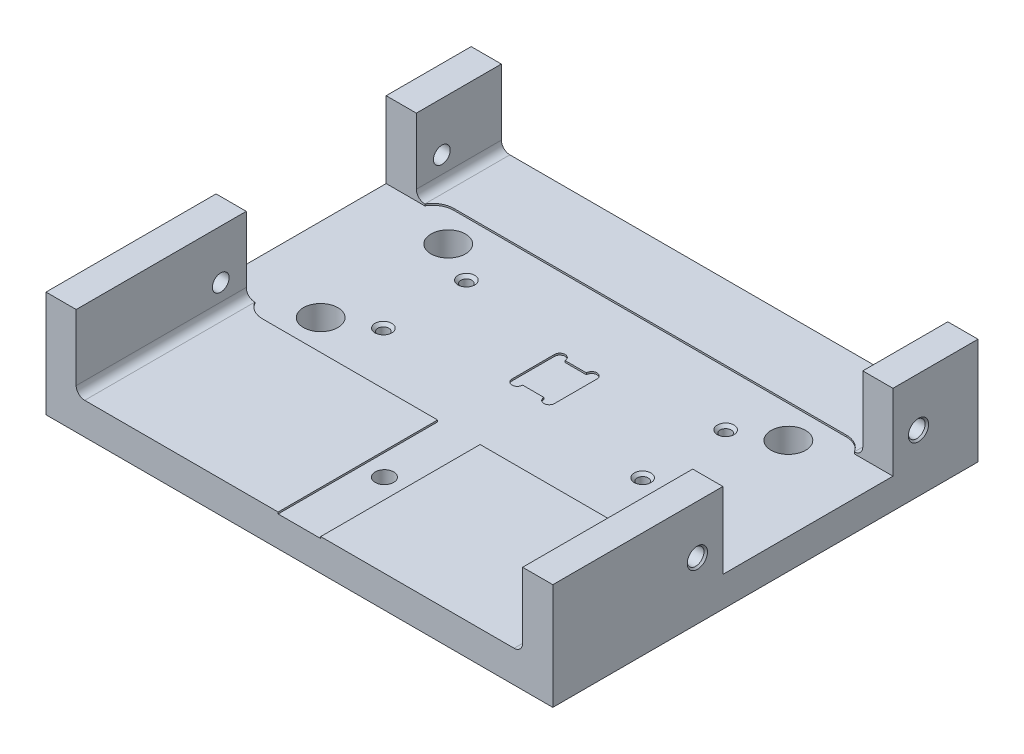
from build123d import *

# Parameters (mm, degrees)
EXTRUDE_THIN1_DEPTH                     = 50.8
FILLET2_R                               = 2.54
CUT_EXTRUDE1_DEPTH                      = 97.928543268
CUT_EXTRUDE1_DEPTH_BACK                 = 97.928543268
SKETCH5_W                               = 25.4
SKETCH5_H                               = 22.733
CUT_EXTRUDE2_START                      = 9.017
CUT_EXTRUDE2_DEPTH                      = 0.508
CUT_EXTRUDE3_START                      = -76.2
SKETCH8_W                               = 50.8
SKETCH8_H                               = 31.75
CUT_EXTRUDE3_DEPTH                      = 0.508
M4X0_7_TAPPED_HOLE2_D                   = 3.3
M4X0_7_TAPPED_HOLE2_CSINK_D             = 5
M4X0_7_TAPPED_HOLE2_CSINK_ANGLE         = 90
M6X1_0_TAPPED_HOLE1_D                   = 5
M6X1_0_TAPPED_HOLE1_CSINK_D             = 6.05
M6X1_0_TAPPED_HOLE1_CSINK_ANGLE         = 90
MIRROR1_2_OUTLINE_R                     = 1.65
MIRROR1_2_DEPTH                         = 9.017
MIRROR1_START                           = 9.017
MIRROR1_3_OUTLINE_W                     = 75.692
MIRROR1_3_OUTLINE_H                     = 25.4
MIRROR1_3_OUTLINE_W_2                   = 151.384
MIRROR1_3_DEPTH                         = 3.048
MIRROR1_START_2                         = 9.8422079
MIRROR1_4_OUTLINE_W                     = 9.017
MIRROR1_4_OUTLINE_H                     = 25.4
MIRROR1_4_DEPTH                         = 21.9077921
MIRROR1_5_DEPTH                         = 8.509
MIRROR1_START_3                         = -50.8
MIRROR1_6_DEPTH                         = 101.6
SKETCH14_W                              = 12.7
SKETCH14_H                              = 50.8
CUT_EXTRUDE4_DEPTH                      = 0.508
BOSS_EXTRUDE1_DEPTH                     = 25.4
CBORE_FOR_M5_HEX_HEAD_BOLT1_D           = 5.5
CBORE_FOR_M5_HEX_HEAD_BOLT1_DEPTH       = 12.3063
CBORE_FOR_M5_HEX_HEAD_BOLT1_CBORE_D     = 12.24
CBORE_FOR_M5_HEX_HEAD_BOLT1_CBORE_DEPTH = 3.58
CBORE_FOR_M5_HEX_HEAD_BOLT1_TIP         = 1.652366702
CUT_EXTRUDE6_DEPTH                      = 0.508
FILLET3_R                               = 6.35


with BuildPart() as part:
    # Sketch4 → Extrude-Thin1 (new body)
    with BuildSketch(Plane.XY):
        Polygon((0, 0), (-76.2, 0), (-76.2, 31.75), (-66.675, 31.75), (-66.675, 9.525), (0, 9.525), align=None)
    extrude(amount=EXTRUDE_THIN1_DEPTH)

    # Fillet2
    fillet2_edges = [part.edges().sort_by_distance(p)[0] for p in [
        (-66.675, 9.525, 25.4),
    ]]
    fillet(fillet2_edges, radius=FILLET2_R)

    # Sketch5 → Cut-Extrude1 (cut, two sides: drawn at the far end of the back side and taken through both)
    with BuildSketch(Plane(origin=(0, 0, 0), x_dir=(0, 0, -1), z_dir=(1, 0, 0)).offset(-CUT_EXTRUDE1_DEPTH_BACK)):
        with Locations((-12.7, 20.3835)):
            Rectangle(SKETCH5_W, SKETCH5_H)
    extrude(amount=CUT_EXTRUDE1_DEPTH + CUT_EXTRUDE1_DEPTH_BACK, mode=Mode.SUBTRACT)

    # Sketch7 → Cut-Extrude2 (cut)
    with BuildSketch(Plane(origin=(0, 0, 0), x_dir=(1, 0, 0), z_dir=(0, 1, 0)).offset(CUT_EXTRUDE2_START)):
        with BuildLine():
            Line((0, 0), (-6.35, 0))
            Line((-6.35, 0), (-6.35, -6.35))
            ThreePointArc((-6.35, -6.35), (-4.7625, -7.9375), (-3.175, -6.35))
            Line((-3.175, -6.35), (0, -6.35))
            Line((0, -6.35), (0, 0))
        make_face()
    extrude(amount=-CUT_EXTRUDE2_DEPTH, mode=Mode.SUBTRACT)

    # Sketch8 → Cut-Extrude3 (cut)
    with BuildSketch(Plane(origin=(0, 0, 0), x_dir=(0, 0, -1), z_dir=(1, 0, 0)).offset(CUT_EXTRUDE3_START)):
        with Locations((-25.4, 15.875)):
            Rectangle(SKETCH8_W, SKETCH8_H)
    extrude(amount=CUT_EXTRUDE3_DEPTH, mode=Mode.SUBTRACT)

    # M4x0.7 Tapped Hole2 (through all)
    with Locations(Plane(origin=(0, 9.017, 0), x_dir=(1, 0, 0), z_dir=(0, 1, 0))):
        with Locations((-38.718585116, -12.4)):
            CounterSinkHole(M4X0_7_TAPPED_HOLE2_D / 2, M4X0_7_TAPPED_HOLE2_CSINK_D / 2, counter_sink_angle=M4X0_7_TAPPED_HOLE2_CSINK_ANGLE)

    # M6x1.0 Tapped Hole1 (through all)
    with Locations(Plane.ZY.offset(75.692)):
        with Locations((33.02, 17.145)):
            CounterSinkHole(M6X1_0_TAPPED_HOLE1_D / 2, M6X1_0_TAPPED_HOLE1_CSINK_D / 2, counter_sink_angle=M6X1_0_TAPPED_HOLE1_CSINK_ANGLE)

    # Mirror1 2 outline → Mirror1 2 (add)
    with BuildSketch(Plane(origin=(0, 0, 0), x_dir=(1, 0, 0), z_dir=(0, 1, 0))):
        with BuildLine():
            Line((75.692, -50.8), (75.692, 50.8))
            Line((75.692, 50.8), (-75.692, 50.8))
            Line((-75.692, 50.8), (-75.692, 0))
            Line((-75.692, 0), (-6.35, 0))
            Line((-6.35, 0), (-6.35, 6.35))
            ThreePointArc((-6.35, 6.35), (-4.7625, 7.9375), (-3.175, 6.35))
            Line((-3.175, 6.35), (3.175, 6.35))
            ThreePointArc((3.175, 6.35), (4.7625, 7.9375), (6.35, 6.35))
            Line((6.35, 6.35), (6.35, -6.35))
            ThreePointArc((6.35, -6.35), (4.7625, -7.9375), (3.175, -6.35))
            Line((3.175, -6.35), (0, -6.35))
            Line((0, -6.35), (0, -50.8))
            Line((0, -50.8), (75.692, -50.8))
        make_face()
        with Locations((38.718585116, 12.4)):
            Circle(MIRROR1_2_OUTLINE_R, mode=Mode.SUBTRACT)
        with Locations((-38.718585116, 12.4)):
            Circle(MIRROR1_2_OUTLINE_R, mode=Mode.SUBTRACT)
        with Locations((38.718585116, -12.4)):
            Circle(MIRROR1_2_OUTLINE_R, mode=Mode.SUBTRACT)
    extrude(amount=MIRROR1_2_DEPTH)

    # Mirror1 3 outline → Mirror1 3 (add)
    with BuildSketch(Plane(origin=(0, 0, 0), x_dir=(1, 0, 0), z_dir=(0, 1, 0)).offset(MIRROR1_START)):
        with Locations((37.846, -38.1)):
            Rectangle(MIRROR1_3_OUTLINE_W, MIRROR1_3_OUTLINE_H)
        with Locations((0, 38.1)):
            Rectangle(MIRROR1_3_OUTLINE_W_2, MIRROR1_3_OUTLINE_H)
    extrude(amount=MIRROR1_3_DEPTH)



with BuildPart() as body_2:
    # Mirror1: read off the stored shape, not the designer's step
    # Mirror1 outline → Mirror1 (revolve)
    with BuildSketch(Plane(origin=(0, 17.145, -33.02), x_dir=(0, 1, 0), z_dir=(0, 0, -1))):
        Polygon((3.025, -66.675), (2.5, -66.675), (2.5, -75.167), (3.025, -75.692), align=None)
        Polygon((2.5, 75.167), (2.5, 66.675), (3.025, 66.675), (3.025, 75.692), align=None)
    revolve(axis=Axis((0, 17.145, -33.02), (1, 0, 0)))


with BuildPart() as part_1:
    add(part.part)

    add(body_2.part)  # Mirror1 4 merges body 2
    # Mirror1 4 outline → Mirror1 4 (add)
    with BuildSketch(Plane(origin=(0, 0, 0), x_dir=(1, 0, 0), z_dir=(0, 1, 0)).offset(MIRROR1_START_2)):
        with Locations((71.1835, -38.1)):
            Rectangle(MIRROR1_4_OUTLINE_W, MIRROR1_4_OUTLINE_H)
        with Locations((71.1835, 38.1)):
            Rectangle(MIRROR1_4_OUTLINE_W, MIRROR1_4_OUTLINE_H)
        with Locations((-71.1835, 38.1)):
            Rectangle(MIRROR1_4_OUTLINE_W, MIRROR1_4_OUTLINE_H)
    extrude(amount=MIRROR1_4_DEPTH)

    # Mirror1 5 outline → Mirror1 5 (add)
    with BuildSketch(Plane(origin=(0, 0, 0), x_dir=(1, 0, 0), z_dir=(0, 1, 0))):
        with BuildLine():
            Line((0, 0), (0, -6.35))
            Line((0, -6.35), (3.175, -6.35))
            ThreePointArc((3.175, -6.35), (4.7625, -7.9375), (6.35, -6.35))
            Line((6.35, -6.35), (6.35, 6.35))
            ThreePointArc((6.35, 6.35), (4.7625, 7.9375), (3.175, 6.35))
            Line((3.175, 6.35), (-3.175, 6.35))
            ThreePointArc((-3.175, 6.35), (-4.7625, 7.9375), (-6.35, 6.35))
            Line((-6.35, 6.35), (-6.35, 0))
            Line((-6.35, 0), (0, 0))
        make_face()
    extrude(amount=MIRROR1_5_DEPTH)

    # Mirror1 6 outline → Mirror1 6 (cut)
    with BuildSketch(Plane.XY.offset(MIRROR1_START_3)):
        with BuildLine():
            ThreePointArc((-66.675, 12.065), (-65.931051224, 10.268948776), (-64.135, 9.525))
            Line((-64.135, 9.525), (64.135, 9.525))
            ThreePointArc((64.135, 9.525), (65.931051224, 10.268948776), (66.675, 12.065))
            Line((66.675, 12.065), (-66.675, 12.065))
        make_face()
    extrude(amount=MIRROR1_6_DEPTH, mode=Mode.SUBTRACT)

    # Mirror1 7 outline → Mirror1 7 (revolve, cut)
    with BuildSketch(Plane(origin=(0, 17.145, 33.02), x_dir=(0, 1, 0), z_dir=(0, 0, -1))):
        Polygon((0, 66.675), (2.5, 66.675), (2.5, 75.167), (3.025, 75.692), (0, 75.692), align=None)
    revolve(axis=Axis((0, 17.145, 33.02), (1, 0, 0)), mode=Mode.SUBTRACT)

    # Mirror1 8 outline → Mirror1 8 (revolve, cut)
    with BuildSketch(Plane(origin=(-38.718585116, 0, -12.4), x_dir=(1, 0, 0), z_dir=(0, 0, 1))):
        Polygon((1.65, 9.017), (1.65, 8.167), (2.5, 9.017), align=None)
    revolve(axis=Axis((-38.718585116, 0, -12.4), (0, 1, 0)), mode=Mode.SUBTRACT)

    # Mirror1 9 outline → Mirror1 9 (revolve, cut)
    with BuildSketch(Plane(origin=(0, 17.145, -33.02), x_dir=(0, 1, 0), z_dir=(0, 0, -1))):
        Polygon((2.5, -75.167), (2.5, -66.675), (0, -66.675), (0, -75.692), (3.025, -75.692), align=None)
        Polygon((0, 66.675), (2.5, 66.675), (2.5, 75.167), (3.025, 75.692), (0, 75.692), align=None)
    revolve(axis=Axis((0, 17.145, -33.02), (1, 0, 0)), mode=Mode.SUBTRACT)

    # Mirror1 10 outline → Mirror1 10 (revolve, cut)
    with BuildSketch(Plane(origin=(38.718585116, 0, 12.4), x_dir=(1, 0, 0), z_dir=(0, 0, 1))):
        Polygon((1.65, 9.017), (1.65, 8.167), (2.5, 9.017), align=None)
    revolve(axis=Axis((38.718585116, 0, 12.4), (0, 1, 0)), mode=Mode.SUBTRACT)

    # Mirror1 11 outline → Mirror1 11 (revolve, cut)
    with BuildSketch(Plane(origin=(38.718585116, 0, -12.4), x_dir=(1, 0, 0), z_dir=(0, 0, 1))):
        Polygon((1.65, 9.017), (1.65, 8.167), (2.5, 9.017), align=None)
    revolve(axis=Axis((38.718585116, 0, -12.4), (0, 1, 0)), mode=Mode.SUBTRACT)

    # Sketch14 → Cut-Extrude4 (cut)
    with BuildSketch(Plane(origin=(0, 9.525, 0), x_dir=(1, 0, 0), z_dir=(0, 1, 0))):
        with Locations((0, -25.4)):
            Rectangle(SKETCH14_W, SKETCH14_H)
    extrude(amount=-CUT_EXTRUDE4_DEPTH, mode=Mode.SUBTRACT)

    # Sketch15 → Boss-Extrude1 (add)
    with BuildSketch(Plane.XY.offset(50.8)):
        with BuildLine():
            Line((-75.692, 0), (75.692, 0))
            Line((75.692, 0), (75.692, 31.75))
            Line((75.692, 31.75), (66.675, 31.75))
            Line((66.675, 31.75), (66.675, 12.065))
            ThreePointArc((66.675, 12.065), (65.931051224, 10.268948776), (64.135, 9.525))
            Line((64.135, 9.525), (6.35, 9.525))
            Line((6.35, 9.525), (6.35, 9.017))
            Line((6.35, 9.017), (-6.35, 9.017))
            Line((-6.35, 9.017), (-6.35, 9.525))
            Line((-6.35, 9.525), (-64.135, 9.525))
            ThreePointArc((-64.135, 9.525), (-65.931051224, 10.268948776), (-66.675, 12.065))
            Line((-66.675, 12.065), (-66.675, 31.75))
            Line((-66.675, 31.75), (-75.692, 31.75))
            Line((-75.692, 31.75), (-75.692, 0))
        make_face()
    extrude(amount=BOSS_EXTRUDE1_DEPTH)

    # CBORE for M5 Hex Head Bolt1
    with Locations(Plane(origin=(0, 0, 0), x_dir=(-1, 0, 0), z_dir=(0, -1, 0))):
        with Locations((0, -50.8)):
            CounterBoreHole(CBORE_FOR_M5_HEX_HEAD_BOLT1_D / 2, CBORE_FOR_M5_HEX_HEAD_BOLT1_CBORE_D / 2, CBORE_FOR_M5_HEX_HEAD_BOLT1_CBORE_DEPTH, depth=CBORE_FOR_M5_HEX_HEAD_BOLT1_DEPTH)
            with Locations((0, 0, -(CBORE_FOR_M5_HEX_HEAD_BOLT1_DEPTH + CBORE_FOR_M5_HEX_HEAD_BOLT1_TIP / 2))):  # 118° drill point
                Cone(0, CBORE_FOR_M5_HEX_HEAD_BOLT1_D / 2, CBORE_FOR_M5_HEX_HEAD_BOLT1_TIP, mode=Mode.SUBTRACT)

    # Sketch24 → 3/8 Clearance Hole2 (revolve, cut)
    with BuildSketch(Plane(origin=(50.8, 0, -19.05), x_dir=(0, 0, -1), z_dir=(1, 0, 0))):
        Polygon((0, 0), (0, 15.40598371), (5.15874, 12.3063), (5.15874, 0), align=None)
    f_3_8_clearance_hole2 = revolve(axis=Axis((50.8, -6.35, -19.05), (0, 1, 0)), mode=Mode.SUBTRACT)

    # Sketch25 → Cut-Extrude6 (cut)
    with BuildSketch(Plane(origin=(0, 9.525, 0), x_dir=(1, 0, 0), z_dir=(0, 1, 0))):
        Polygon((53.975, 28.575), (64.135, 28.575), (64.135, 25.4), (-64.135, 25.4), (-64.135, 28.575), (47.625, 28.575), align=None)
    cut_extrude6 = extrude(amount=-CUT_EXTRUDE6_DEPTH, mode=Mode.SUBTRACT)

    # Mirror3: Cut-Extrude6 across plane
    add(cut_extrude6.mirror(Plane.XY), mode=Mode.SUBTRACT)

    # Mirror3 at the second plane: Cut-Extrude6 across plane
    add(cut_extrude6.mirror(Plane(origin=(0, 0, 0), x_dir=(0, 0, 1), z_dir=(1, 0, 0))), mode=Mode.SUBTRACT)

    # Mirror2: 3/8 Clearance Hole2 across plane
    add(f_3_8_clearance_hole2.mirror(Plane(origin=(0, 0, 0), x_dir=(0, 0, 1), z_dir=(1, 0, 0))), mode=Mode.SUBTRACT)

    # Mirror2 at the second plane: 3/8 Clearance Hole2 across plane
    add(f_3_8_clearance_hole2.mirror(Plane.XY), mode=Mode.SUBTRACT)

    # Mirror2 at the second plane copy 1 sketc → Mirror2 at the second plane copy 1 (revolve, cut)
    with BuildSketch(Plane(origin=(-50.8, 0, 19.05), x_dir=(0, 0, 1), z_dir=(-1, 0, 0))):
        Polygon((0, 0), (0, 15.40598371), (5.15874, 12.3063), (5.15874, 0), align=None)
    revolve(axis=Axis((-50.8, -6.35, 19.05), (0, 1, 0)), mode=Mode.SUBTRACT)

    # Fillet3
    # the kernel refuses this fillet: 6.35 mm, written as the material it adds along each edge
    with BuildSketch(Plane(origin=(64.135, 9.525, -28.575), x_dir=(-1, 0, 0), z_dir=(0, -1, 0))) as fillet3_piece_1_section:
        with BuildLine():
            CenterArc((5.499261314, -6.35), FILLET3_R, 90, 60)
            Line((0, -3.175), (0, 0))
            Line((0, 0), (5.499261314, 0))
        make_face()
    fillet3_piece_1 = extrude(amount=14.256153285, mode=Mode.PRIVATE)
    fillet3_piece_1 = split(fillet3_piece_1, bisect_by=Plane(origin=(64.135, 0, -28.575), z_dir=(0, 1, 0)), keep=Keep.TOP, mode=Mode.PRIVATE)
    add(fillet3_piece_1)
    with BuildSketch(Plane(origin=(-64.135, 9.525, -28.575), x_dir=(0, 0, 1), z_dir=(0, -1, 0))) as fillet3_piece_2_section:
        with BuildLine():
            CenterArc((6.35, -5.499261314), FILLET3_R, 120, 60)
            Line((0, -5.499261314), (0, 0))
            Line((0, 0), (3.175, 0))
        make_face()
    fillet3_piece_2 = extrude(amount=14.256153285, mode=Mode.PRIVATE)
    fillet3_piece_2 = split(fillet3_piece_2, bisect_by=Plane(origin=(-64.135, 0, -28.575), z_dir=(0, 1, 0)), keep=Keep.TOP, mode=Mode.PRIVATE)
    add(fillet3_piece_2)
    with BuildSketch(Plane(origin=(64.135, 9.525, 28.575), x_dir=(-1, 0, 0), z_dir=(0, -1, 0))) as fillet3_piece_3_section:
        with BuildLine():
            CenterArc((5.499261314, 6.35), FILLET3_R, 210, 60)
            Line((0, 3.175), (0, 0))
            Line((0, 0), (5.499261314, 0))
        make_face()
    fillet3_piece_3 = extrude(amount=14.256153285, mode=Mode.PRIVATE)
    fillet3_piece_3 = split(fillet3_piece_3, bisect_by=Plane(origin=(64.135, 0, 28.575), z_dir=(0, 1, 0)), keep=Keep.TOP, mode=Mode.PRIVATE)
    add(fillet3_piece_3)
    with BuildSketch(Plane(origin=(-64.135, 9.525, 28.575), x_dir=(0, 0, -1), z_dir=(0, -1, 0))) as fillet3_piece_4_section:
        with BuildLine():
            CenterArc((6.35, 5.499261314), FILLET3_R, 180, 60)
            Line((0, 5.499261314), (0, 0))
            Line((0, 0), (3.175, 0))
        make_face()
    fillet3_piece_4 = extrude(amount=14.256153285, mode=Mode.PRIVATE)
    fillet3_piece_4 = split(fillet3_piece_4, bisect_by=Plane(origin=(-64.135, 0, 28.575), z_dir=(0, 1, 0)), keep=Keep.TOP, mode=Mode.PRIVATE)
    add(fillet3_piece_4)


solid = part_1.part
